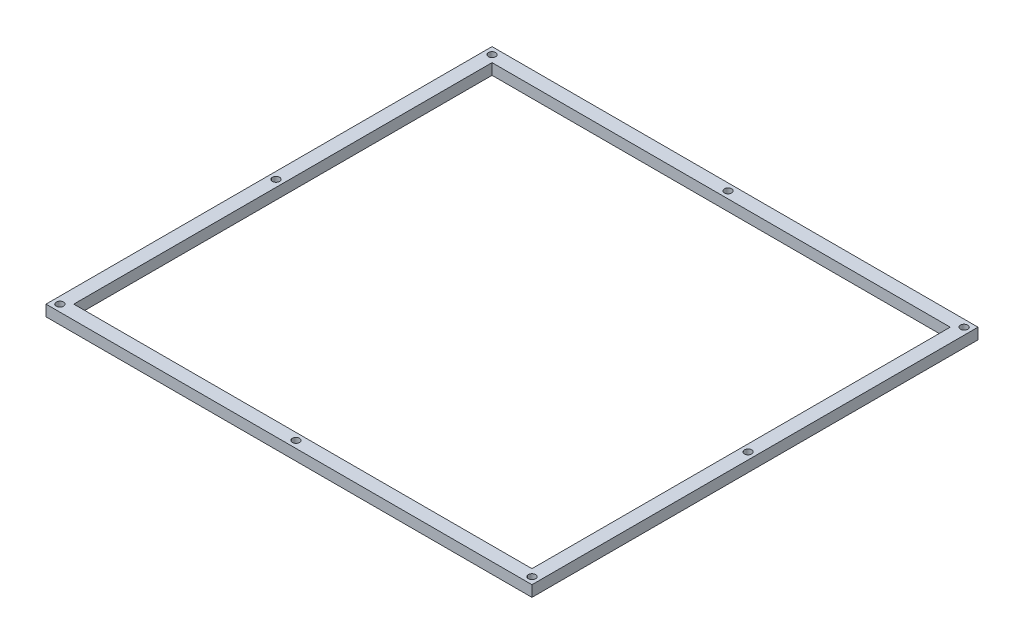
from build123d import *

# Parameters (mm, degrees)
SKETCH1_W           = 280
SKETCH1_H           = 257
SKETCH1_W_2         = 264
SKETCH1_H_2         = 241
BOSS_EXTRUDE1_DEPTH = 6.35
SKETCH2_R           = 2.1
CUT_EXTRUDE1_DEPTH  = 381.117511436


with BuildPart() as part:
    # Sketch1 → Boss-Extrude1 (new body)
    with BuildSketch(Plane(origin=(0, 0, 0), x_dir=(1, 0, 0), z_dir=(0, 1, 0))):
        with Locations((140, 128.5)):
            Rectangle(SKETCH1_W, SKETCH1_H)
        with Locations((140, 128.5)):
            Rectangle(SKETCH1_W_2, SKETCH1_H_2, mode=Mode.SUBTRACT)
    extrude(amount=BOSS_EXTRUDE1_DEPTH)

    # Sketch2 → Cut-Extrude1 (cut, through all)
    with BuildSketch(Plane(origin=(0, 6.35, 0), x_dir=(1, 0, 0), z_dir=(0, 1, 0))):
        with Locations((4, 253)):
            Circle(SKETCH2_R)
        with Locations((4, 4)):
            Circle(SKETCH2_R)
        with Locations((276, 253)):
            Circle(SKETCH2_R)
        with Locations((276, 4)):
            Circle(SKETCH2_R)
        with Locations((140, 253)):
            Circle(SKETCH2_R)
        with Locations((4, 128.5)):
            Circle(SKETCH2_R)
        with Locations((140, 4)):
            Circle(SKETCH2_R)
        with Locations((276, 128.5)):
            Circle(SKETCH2_R)
    extrude(amount=-CUT_EXTRUDE1_DEPTH, mode=Mode.SUBTRACT)


solid = part.part
